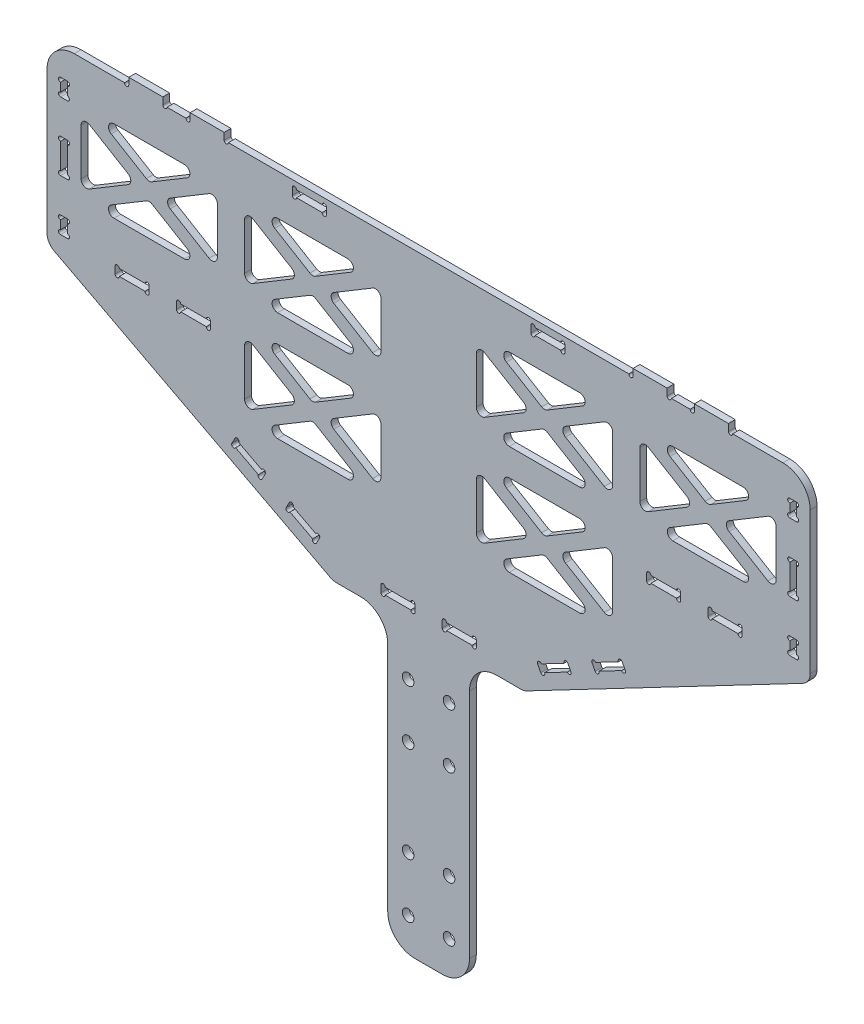
from build123d import *

# Parameters (mm, degrees)
EXTRUDE_1_DEPTH                = 5
SKETCH_2_R                     = 4.25
CUT_EXTRUDE_1_DEPTH            = 26
FILLET_1_R                     = 20
SKETCH_3_W                     = 61.624102005
SKETCH_3_H                     = 24.649640802
EXTRUDE_2_DEPTH                = 5
CUT_EXTRUDE_6_DEPTH            = 5
FILLET_2_R                     = 4
PATTERN_LINEAR_1_COUNT         = 2
PATTERN_LINEAR_1_PITCH         = 120
PATTERN_LINEAR_1_COUNT_DIR2    = 2
PATTERN_LINEAR_1_PITCH_DIR2    = 80
FILLET_2_OF_PATTERN_LINEAR_1_R = 4
MIRROR_1_DEPTH                 = 5
CUT_EXTRUDE_7_DEPTH            = 10
CUT_EXTRUDE_8_DEPTH            = 10
FILLET_3_R                     = 10
SKETCH_11_W                    = 25
SKETCH_11_H                    = 5
CUT_EXTRUDE_9_DEPTH            = 10
SKETCH_12_R                    = 1.55
CUT_EXTRUDE_10_DEPTH           = 10
SKETCH_13_W                    = 5
SKETCH_13_H                    = 12.5
SKETCH_13_H_2                  = 25
CUT_EXTRUDE_11_DEPTH           = 10
SKETCH_14_R                    = 1.55
CUT_EXTRUDE_12_DEPTH           = 10
CUT_EXTRUDE_13_DEPTH           = 10
SKETCH_16_W                    = 25
SKETCH_16_H                    = 5
EXTRUDE_3_DEPTH                = 5
SKETCH_17_R                    = 1.55
CUT_EXTRUDE_14_DEPTH           = 5


# Read off the part's stored shape, not the designer's step: 镜向1
with BuildPart() as part:
    # 草图1 → 凸台-拉伸1 (new body)
    with BuildSketch(Plane.XY):
        Polygon((-30, 0), (30, 0), (30, 210), (280, 210), (280, 450), (-280, 450), (-280, 210), (-30, 210), align=None)
    extrude(amount=EXTRUDE_1_DEPTH)

    # 草图2 → 切除-拉伸1 (cut)
    with BuildSketch(Plane.XY.offset(5)):
        with Locations((15, 25)):
            Circle(SKETCH_2_R)
        with Locations((15, 65)):
            Circle(SKETCH_2_R)
        with Locations((15, 135)):
            Circle(SKETCH_2_R)
        with Locations((15, 175)):
            Circle(SKETCH_2_R)
        with Locations(Location((-15, 175, 0), (0, 0, 180))):
            Circle(SKETCH_2_R)
        with Locations(Location((-15, 135, 0), (0, 0, 180))):
            Circle(SKETCH_2_R)
        with Locations(Location((-15, 65, 0), (0, 0, 180))):
            Circle(SKETCH_2_R)
        with Locations(Location((-15, 25, 0), (0, 0, 180))):
            Circle(SKETCH_2_R)
    extrude(amount=-CUT_EXTRUDE_1_DEPTH, mode=Mode.SUBTRACT)

    # 圆角1
    fillet_1_edges = [part.edges().sort_by_distance(p)[0] for p in [
        (30, 0, 2.5),
        (-30, 0, 2.5),
        (-30, 210, 2.5),
        (-280, 210, 2.5),
        (-280, 450, 2.5),
        (280, 450, 2.5),
        (280, 210, 2.5),
        (30, 210, 2.5),
    ]]
    fillet(fillet_1_edges, radius=FILLET_1_R)

    # 草图3 → 凸台-拉伸2 (add)
    with BuildSketch(Plane.XY.offset(5)):
        with Locations((-121.322450822, 379.637980968)):
            Rectangle(SKETCH_3_W, SKETCH_3_H)
    extrude(amount=-EXTRUDE_2_DEPTH)

    # 草图8 → 切除-拉伸6 (cut)
    with BuildSketch(Plane(origin=(0, 0, 0), x_dir=(-1, 0, 0), z_dir=(0, 0, -1))):
        Polygon((-245.281746842, 420), (-164.718253158, 420), (-205, 395.830951895), align=None)
        Polygon((-255, 414.169048105), (-255, 365.830951895), (-214.718253158, 390), align=None)
        Polygon((-245.281746842, 360), (-164.718253158, 360), (-205, 384.169048105), align=None)
        Polygon((-155, 414.169048105), (-155, 365.830951895), (-195.281746842, 390), align=None)
    cut_extrude_6 = extrude(amount=-CUT_EXTRUDE_6_DEPTH, mode=Mode.SUBTRACT)

    # 圆角2
    fillet_2_edges = [part.edges().sort_by_distance(p)[0] for p in [
        (255, 414.169048105, 2.5),
        (214.718253158, 390, 2.5),
        (255, 365.830951895, 2.5),
        (195.281746842, 390, 2.5),
        (155, 414.169048105, 2.5),
        (155, 365.830951895, 2.5),
        (205, 384.169048105, 2.5),
        (164.718253158, 360, 2.5),
        (245.281746842, 360, 2.5),
        (205, 395.830951895, 2.5),
        (245.281746842, 420, 2.5),
        (164.718253158, 420, 2.5),
    ]]
    fillet(fillet_2_edges, radius=FILLET_2_R)

    # 阵列(线性)1: Cut-Extrude 6 2 × 2, 1 skipped
    with Locations(*[(-i * PATTERN_LINEAR_1_PITCH, -j * PATTERN_LINEAR_1_PITCH_DIR2, 0) for i in range(PATTERN_LINEAR_1_COUNT) for j in range(PATTERN_LINEAR_1_COUNT_DIR2) if (i, j) not in ((0, 0), (0, 1))]):
        add(cut_extrude_6, mode=Mode.SUBTRACT)

    # 圆角2 of 阵列(线性)1
    fillet_2_of_pattern_linear_1_edges = [part.edges().sort_by_distance(p)[0] for p in [
        (135, 414.169048105, 2.5),
        (94.718253158, 390, 2.5),
        (135, 365.830951895, 2.5),
        (75.281746842, 390, 2.5),
        (35, 414.169048105, 2.5),
        (35, 365.830951895, 2.5),
        (85, 384.169048105, 2.5),
        (44.718253158, 360, 2.5),
        (125.281746842, 360, 2.5),
        (85, 395.830951895, 2.5),
        (125.281746842, 420, 2.5),
        (44.718253158, 420, 2.5),
        (135, 334.169048105, 2.5),
        (94.718253158, 310, 2.5),
        (135, 285.830951895, 2.5),
        (75.281746842, 310, 2.5),
        (35, 334.169048105, 2.5),
        (35, 285.830951895, 2.5),
        (85, 304.169048105, 2.5),
        (44.718253158, 280, 2.5),
        (125.281746842, 280, 2.5),
        (85, 315.830951895, 2.5),
        (125.281746842, 340, 2.5),
        (44.718253158, 340, 2.5),
    ]]
    fillet(fillet_2_of_pattern_linear_1_edges, radius=FILLET_2_OF_PATTERN_LINEAR_1_R)

    # 镜向1 outline → 镜向1 (cut)
    with BuildSketch(Plane.XY):
        with BuildLine():
            Line((-110.840477649, 280), (-59.159522351, 280))
            ThreePointArc((-59.159522351, 280), (-55.304662638, 282.932265672), (-57.101539329, 287.429971703))
            Line((-57.101539329, 287.429971703), (-82.942016978, 302.934258292))
            ThreePointArc((-82.942016978, 302.934258292), (-85, 303.504286589), (-87.057983022, 302.934258292))
            Line((-87.057983022, 302.934258292), (-112.898460671, 287.429971703))
            ThreePointArc((-112.898460671, 287.429971703), (-114.695337362, 282.932265672), (-110.840477649, 280))
        make_face()
        with BuildLine():
            Line((-59.159522351, 340), (-110.840477649, 340))
            ThreePointArc((-110.840477649, 340), (-114.695337362, 337.067734328), (-112.898460671, 332.570028297))
            Line((-112.898460671, 332.570028297), (-87.057983022, 317.065741708))
            ThreePointArc((-87.057983022, 317.065741708), (-85, 316.495713411), (-82.942016978, 317.065741708))
            Line((-82.942016978, 317.065741708), (-57.101539329, 332.570028297))
            ThreePointArc((-57.101539329, 332.570028297), (-55.304662638, 337.067734328), (-59.159522351, 340))
        make_face()
        with BuildLine():
            Line((-179.159522351, 420), (-230.840477649, 420))
            ThreePointArc((-230.840477649, 420), (-234.695337362, 417.067734328), (-232.898460671, 412.570028297))
            Line((-232.898460671, 412.570028297), (-207.057983022, 397.065741708))
            ThreePointArc((-207.057983022, 397.065741708), (-205, 396.495713411), (-202.942016978, 397.065741708))
            Line((-202.942016978, 397.065741708), (-177.101539329, 412.570028297))
            ThreePointArc((-177.101539329, 412.570028297), (-175.304662638, 417.067734328), (-179.159522351, 420))
        make_face()
        with BuildLine():
            Line((-59.159522351, 420), (-110.840477649, 420))
            ThreePointArc((-110.840477649, 420), (-114.695337362, 417.067734328), (-112.898460671, 412.570028297))
            Line((-112.898460671, 412.570028297), (-87.057983022, 397.065741708))
            ThreePointArc((-87.057983022, 397.065741708), (-85, 396.495713411), (-82.942016978, 397.065741708))
            Line((-82.942016978, 397.065741708), (-57.101539329, 412.570028297))
            ThreePointArc((-57.101539329, 412.570028297), (-55.304662638, 417.067734328), (-59.159522351, 420))
        make_face()
        with BuildLine():
            Line((-230.840477649, 360), (-179.159522351, 360))
            ThreePointArc((-179.159522351, 360), (-175.304662638, 362.932265672), (-177.101539329, 367.429971703))
            Line((-177.101539329, 367.429971703), (-202.942016978, 382.934258292))
            ThreePointArc((-202.942016978, 382.934258292), (-205, 383.504286589), (-207.057983022, 382.934258292))
            Line((-207.057983022, 382.934258292), (-232.898460671, 367.429971703))
            ThreePointArc((-232.898460671, 367.429971703), (-234.695337362, 362.932265672), (-230.840477649, 360))
        make_face()
        with BuildLine():
            Line((-110.840477649, 360), (-59.159522351, 360))
            ThreePointArc((-59.159522351, 360), (-55.304662638, 362.932265672), (-57.101539329, 367.429971703))
            Line((-57.101539329, 367.429971703), (-82.942016978, 382.934258292))
            ThreePointArc((-82.942016978, 382.934258292), (-85, 383.504286589), (-87.057983022, 382.934258292))
            Line((-87.057983022, 382.934258292), (-112.898460671, 367.429971703))
            ThreePointArc((-112.898460671, 367.429971703), (-114.695337362, 362.932265672), (-110.840477649, 360))
        make_face()
        with BuildLine():
            Line((-248.942016978, 369.465741708), (-220.434872663, 386.570028297))
            ThreePointArc((-220.434872663, 386.570028297), (-218.492855685, 390), (-220.434872663, 393.429971703))
            Line((-220.434872663, 393.429971703), (-248.942016978, 410.534258292))
            ThreePointArc((-248.942016978, 410.534258292), (-252.97079526, 410.585086216), (-255, 407.104286589))
            Line((-255, 407.104286589), (-255, 372.895713411))
            ThreePointArc((-255, 372.895713411), (-252.97079526, 369.414913784), (-248.942016978, 369.465741708))
        make_face()
        with BuildLine():
            Line((-189.565127337, 386.570028297), (-161.057983022, 369.465741708))
            ThreePointArc((-161.057983022, 369.465741708), (-157.02920474, 369.414913784), (-155, 372.895713411))
            Line((-155, 372.895713411), (-155, 407.104286589))
            ThreePointArc((-155, 407.104286589), (-157.02920474, 410.585086216), (-161.057983022, 410.534258292))
            Line((-161.057983022, 410.534258292), (-189.565127337, 393.429971703))
            ThreePointArc((-189.565127337, 393.429971703), (-191.507144315, 390), (-189.565127337, 386.570028297))
        make_face()
        with BuildLine():
            Line((-128.942016978, 289.465741708), (-100.434872663, 306.570028297))
            ThreePointArc((-100.434872663, 306.570028297), (-98.492855685, 310), (-100.434872663, 313.429971703))
            Line((-100.434872663, 313.429971703), (-128.942016978, 330.534258292))
            ThreePointArc((-128.942016978, 330.534258292), (-132.97079526, 330.585086216), (-135, 327.104286589))
            Line((-135, 327.104286589), (-135, 292.895713411))
            ThreePointArc((-135, 292.895713411), (-132.97079526, 289.414913784), (-128.942016978, 289.465741708))
        make_face()
        with BuildLine():
            Line((-135, 407.104286589), (-135, 372.895713411))
            ThreePointArc((-135, 372.895713411), (-132.97079526, 369.414913784), (-128.942016978, 369.465741708))
            Line((-128.942016978, 369.465741708), (-100.434872663, 386.570028297))
            ThreePointArc((-100.434872663, 386.570028297), (-98.492855685, 390), (-100.434872663, 393.429971703))
            Line((-100.434872663, 393.429971703), (-128.942016978, 410.534258292))
            ThreePointArc((-128.942016978, 410.534258292), (-132.97079526, 410.585086216), (-135, 407.104286589))
        make_face()
        with BuildLine():
            Line((-35, 292.895713411), (-35, 327.104286589))
            ThreePointArc((-35, 327.104286589), (-37.02920474, 330.585086216), (-41.057983022, 330.534258292))
            Line((-41.057983022, 330.534258292), (-69.565127337, 313.429971703))
            ThreePointArc((-69.565127337, 313.429971703), (-71.507144315, 310), (-69.565127337, 306.570028297))
            Line((-69.565127337, 306.570028297), (-41.057983022, 289.465741708))
            ThreePointArc((-41.057983022, 289.465741708), (-37.02920474, 289.414913784), (-35, 292.895713411))
        make_face()
        with BuildLine():
            Line((-35, 372.895713411), (-35, 407.104286589))
            ThreePointArc((-35, 407.104286589), (-37.02920474, 410.585086216), (-41.057983022, 410.534258292))
            Line((-41.057983022, 410.534258292), (-69.565127337, 393.429971703))
            ThreePointArc((-69.565127337, 393.429971703), (-71.507144315, 390), (-69.565127337, 386.570028297))
            Line((-69.565127337, 386.570028297), (-41.057983022, 369.465741708))
            ThreePointArc((-41.057983022, 369.465741708), (-37.02920474, 369.414913784), (-35, 372.895713411))
        make_face()
    extrude(amount=MIRROR_1_DEPTH, mode=Mode.SUBTRACT)

    # 草图9 → 切除-拉伸7 (cut)
    with BuildSketch(Plane(origin=(0, 0, 0), x_dir=(-1, 0, 0), z_dir=(0, 0, -1))):
        with BuildLine():
            Line((78.1, 445), (96.9, 445))
            ThreePointArc((96.9, 445), (98.45, 446.55), (100, 445))
            Line((100, 445), (100, 440))
            ThreePointArc((100, 440), (98.45, 438.45), (96.9, 440))
            Line((96.9, 440), (78.1, 440))
            ThreePointArc((78.1, 440), (76.55, 438.45), (75, 440))
            Line((75, 440), (75, 445))
            ThreePointArc((75, 445), (76.55, 446.55), (78.1, 445))
        make_face()
        with BuildLine():
            Line((-100, 445), (-100, 440))
            ThreePointArc((-100, 440), (-98.45, 438.45), (-96.9, 440))
            Line((-96.9, 440), (-78.1, 440))
            ThreePointArc((-78.1, 440), (-76.55, 438.45), (-75, 440))
            Line((-75, 440), (-75, 445))
            ThreePointArc((-75, 445), (-76.55, 446.55), (-78.1, 445))
            Line((-78.1, 445), (-96.9, 445))
            ThreePointArc((-96.9, 445), (-98.45, 446.55), (-100, 445))
        make_face()
    extrude(amount=-CUT_EXTRUDE_7_DEPTH, mode=Mode.SUBTRACT)

    # 草图10 → 切除-拉伸8 (cut)
    with BuildSketch(Plane.XY.offset(5)):
        with BuildLine():
            Line((280, 320), (70, 210))
            Line((70, 210), (260, 210))
            ThreePointArc((260, 210), (274.142135624, 215.857864376), (280, 230))
            Line((280, 230), (280, 320))
        make_face()
        with BuildLine():
            Line((-280, 320), (-70, 210))
            Line((-70, 210), (-260, 210))
            ThreePointArc((-260, 210), (-274.142135624, 215.857864376), (-280, 230))
            Line((-280, 230), (-280, 320))
        make_face()
    extrude(amount=-CUT_EXTRUDE_8_DEPTH, mode=Mode.SUBTRACT)

    # 圆角3
    fillet_3_edges = [part.edges().sort_by_distance(p)[0] for p in [
        (280, 320, 2.5),
        (70, 210, 2.5),
        (-280, 320, 2.5),
        (-70, 210, 2.5),
    ]]
    fillet(fillet_3_edges, radius=FILLET_3_R)

    # 草图11 → 切除-拉伸9 (cut)
    with BuildSketch(Plane.XY.offset(5)):
        with Locations((172.5, 327.5)):
            Rectangle(SKETCH_11_W, SKETCH_11_H)
        with Locations((217.5, 327.5)):
            Rectangle(SKETCH_11_W, SKETCH_11_H)
        with Locations((-217.5, 327.5)):
            Rectangle(SKETCH_11_W, SKETCH_11_H)
        with Locations((-172.5, 327.5)):
            Rectangle(SKETCH_11_W, SKETCH_11_H)
    extrude(amount=-CUT_EXTRUDE_9_DEPTH, mode=Mode.SUBTRACT)

    # 草图12 → 切除-拉伸10 (cut)
    with BuildSketch(Plane.XY.offset(5)):
        with Locations((228.45, 330)):
            Circle(SKETCH_12_R)
        with Locations((206.55, 330)):
            Circle(SKETCH_12_R)
        with Locations((228.45, 325)):
            Circle(SKETCH_12_R)
        with Locations((206.55, 325)):
            Circle(SKETCH_12_R)
        with Locations((183.45, 330)):
            Circle(SKETCH_12_R)
        with Locations((161.55, 330)):
            Circle(SKETCH_12_R)
        with Locations((161.55, 325)):
            Circle(SKETCH_12_R)
        with Locations((183.45, 325)):
            Circle(SKETCH_12_R)
        with Locations((-183.45, 325)):
            Circle(SKETCH_12_R)
        with Locations((-161.55, 325)):
            Circle(SKETCH_12_R)
        with Locations((-161.55, 330)):
            Circle(SKETCH_12_R)
        with Locations((-183.45, 330)):
            Circle(SKETCH_12_R)
        with Locations((-206.55, 325)):
            Circle(SKETCH_12_R)
        with Locations((-228.45, 325)):
            Circle(SKETCH_12_R)
        with Locations((-206.55, 330)):
            Circle(SKETCH_12_R)
        with Locations((-228.45, 330)):
            Circle(SKETCH_12_R)
    extrude(amount=-CUT_EXTRUDE_10_DEPTH, mode=Mode.SUBTRACT)

    # 草图13 → 切除-拉伸11 (cut)
    with BuildSketch(Plane(origin=(0, 0, 0), x_dir=(-1, 0, 0), z_dir=(0, 0, -1))):
        with Locations((-267.5, 423.75)):
            Rectangle(SKETCH_13_W, SKETCH_13_H)
        with Locations((-267.5, 380)):
            Rectangle(SKETCH_13_W, SKETCH_13_H_2)
        with Locations((-267.5, 336.25)):
            Rectangle(SKETCH_13_W, SKETCH_13_H)
        with Locations((267.5, 336.25)):
            Rectangle(SKETCH_13_W, SKETCH_13_H)
        with Locations((267.5, 380)):
            Rectangle(SKETCH_13_W, SKETCH_13_H_2)
        with Locations((267.5, 423.75)):
            Rectangle(SKETCH_13_W, SKETCH_13_H)
    extrude(amount=-CUT_EXTRUDE_11_DEPTH, mode=Mode.SUBTRACT)

    # 草图14 → 切除-拉伸12 (cut)
    with BuildSketch(Plane(origin=(0, 0, 0), x_dir=(-1, 0, 0), z_dir=(0, 0, -1))):
        with Locations((-265, 428.45)):
            Circle(SKETCH_14_R)
        with Locations((-265, 419.05)):
            Circle(SKETCH_14_R)
        with Locations((-270, 428.45)):
            Circle(SKETCH_14_R)
        with Locations((-270, 419.05)):
            Circle(SKETCH_14_R)
        with Locations((-265, 390.95)):
            Circle(SKETCH_14_R)
        with Locations((-270, 390.95)):
            Circle(SKETCH_14_R)
        with Locations((-265, 369.05)):
            Circle(SKETCH_14_R)
        with Locations((-270, 369.05)):
            Circle(SKETCH_14_R)
        with Locations((-265, 340.95)):
            Circle(SKETCH_14_R)
        with Locations((-270, 340.95)):
            Circle(SKETCH_14_R)
        with Locations((-265, 331.55)):
            Circle(SKETCH_14_R)
        with Locations((-270, 331.55)):
            Circle(SKETCH_14_R)
        with Locations((270, 331.55)):
            Circle(SKETCH_14_R)
        with Locations((265, 331.55)):
            Circle(SKETCH_14_R)
        with Locations((270, 340.95)):
            Circle(SKETCH_14_R)
        with Locations((265, 340.95)):
            Circle(SKETCH_14_R)
        with Locations((270, 369.05)):
            Circle(SKETCH_14_R)
        with Locations((265, 369.05)):
            Circle(SKETCH_14_R)
        with Locations((270, 390.95)):
            Circle(SKETCH_14_R)
        with Locations((265, 390.95)):
            Circle(SKETCH_14_R)
        with Locations((270, 419.05)):
            Circle(SKETCH_14_R)
        with Locations((270, 428.45)):
            Circle(SKETCH_14_R)
        with Locations((265, 419.05)):
            Circle(SKETCH_14_R)
        with Locations((265, 428.45)):
            Circle(SKETCH_14_R)
    extrude(amount=-CUT_EXTRUDE_12_DEPTH, mode=Mode.SUBTRACT)

    # 草图15 → 切除-拉伸13 (cut)
    with BuildSketch(Plane.XY.offset(5)):
        with BuildLine():
            Line((-139.26212971, 263.213405455), (-122.608496847, 254.490073955))
            ThreePointArc((-122.608496847, 254.490073955), (-120.516247126, 255.143901993), (-119.862419088, 253.051652271))
            Line((-119.862419088, 253.051652271), (-122.182454061, 248.622494595))
            ThreePointArc((-122.182454061, 248.622494595), (-124.274703782, 247.968666557), (-124.92853182, 250.060916278))
            Line((-124.92853182, 250.060916278), (-141.582164684, 258.784247778))
            ThreePointArc((-141.582164684, 258.784247778), (-143.674414405, 258.13041974), (-144.328242443, 260.222669462))
            Line((-144.328242443, 260.222669462), (-142.00820747, 264.651827138))
            ThreePointArc((-142.00820747, 264.651827138), (-139.915957748, 265.305655176), (-139.26212971, 263.213405455))
        make_face()
        with BuildLine():
            Line((-102.145788382, 243.771512378), (-104.465823355, 239.342354702))
            ThreePointArc((-104.465823355, 239.342354702), (-103.811995317, 237.25010498), (-101.719745596, 237.903933018))
            Line((-101.719745596, 237.903933018), (-85.066112733, 229.180601518))
            ThreePointArc((-85.066112733, 229.180601518), (-84.412284695, 227.088351797), (-82.320034973, 227.742179835))
            Line((-82.320034973, 227.742179835), (-80, 232.171337511))
            ThreePointArc((-80, 232.171337511), (-80.653828038, 234.263587233), (-82.746077759, 233.609759195))
            Line((-82.746077759, 233.609759195), (-99.399710623, 242.333090694))
            ThreePointArc((-99.399710623, 242.333090694), (-100.053538661, 244.425340416), (-102.145788382, 243.771512378))
        make_face()
        with BuildLine():
            Line((10, 225), (10, 220))
            ThreePointArc((10, 220), (11.55, 218.45), (13.1, 220))
            Line((13.1, 220), (31.9, 220))
            ThreePointArc((31.9, 220), (33.45, 218.45), (35, 220))
            Line((35, 220), (35, 225))
            ThreePointArc((35, 225), (33.45, 226.55), (31.9, 225))
            Line((31.9, 225), (13.1, 225))
            ThreePointArc((13.1, 225), (11.55, 226.55), (10, 225))
        make_face()
        with BuildLine():
            Line((-31.9, 225), (-13.1, 225))
            ThreePointArc((-13.1, 225), (-11.55, 226.55), (-10, 225))
            Line((-10, 225), (-10, 220))
            ThreePointArc((-10, 220), (-11.55, 218.45), (-13.1, 220))
            Line((-13.1, 220), (-31.9, 220))
            ThreePointArc((-31.9, 220), (-33.45, 218.45), (-35, 220))
            Line((-35, 220), (-35, 225))
            ThreePointArc((-35, 225), (-33.45, 226.55), (-31.9, 225))
        make_face()
        with BuildLine():
            Line((82.746077759, 233.609759195), (99.399710623, 242.333090694))
            ThreePointArc((99.399710623, 242.333090694), (100.053538661, 244.425340416), (102.145788382, 243.771512378))
            Line((102.145788382, 243.771512378), (104.465823355, 239.342354702))
            ThreePointArc((104.465823355, 239.342354702), (103.811995317, 237.25010498), (101.719745596, 237.903933018))
            Line((101.719745596, 237.903933018), (85.066112733, 229.180601518))
            ThreePointArc((85.066112733, 229.180601518), (84.412284695, 227.088351797), (82.320034973, 227.742179835))
            Line((82.320034973, 227.742179835), (80, 232.171337511))
            ThreePointArc((80, 232.171337511), (80.653828038, 234.263587233), (82.746077759, 233.609759195))
        make_face()
        with BuildLine():
            Line((144.328242443, 260.222669462), (142.00820747, 264.651827138))
            ThreePointArc((142.00820747, 264.651827138), (139.915957748, 265.305655176), (139.26212971, 263.213405455))
            Line((139.26212971, 263.213405455), (122.608496847, 254.490073955))
            ThreePointArc((122.608496847, 254.490073955), (120.516247126, 255.143901993), (119.862419088, 253.051652271))
            Line((119.862419088, 253.051652271), (122.182454061, 248.622494595))
            ThreePointArc((122.182454061, 248.622494595), (124.274703782, 247.968666557), (124.92853182, 250.060916278))
            Line((124.92853182, 250.060916278), (141.582164684, 258.784247778))
            ThreePointArc((141.582164684, 258.784247778), (143.674414405, 258.13041974), (144.328242443, 260.222669462))
        make_face()
    extrude(amount=-CUT_EXTRUDE_13_DEPTH, mode=Mode.SUBTRACT)

    # 草图16 → 凸台-拉伸3 (add)
    with BuildSketch(Plane.XY.offset(5)):
        with Locations((162.5, 452.5)):
            Rectangle(SKETCH_16_W, SKETCH_16_H)
        with Locations((-207.5, 452.5)):
            Rectangle(SKETCH_16_W, SKETCH_16_H)
        with Locations((207.5, 452.5)):
            Rectangle(SKETCH_16_W, SKETCH_16_H)
        with Locations((-162.5, 452.5)):
            Rectangle(SKETCH_16_W, SKETCH_16_H)
    extrude(amount=-EXTRUDE_3_DEPTH)

    # 草图17 → 切除-拉伸14 (cut)
    with BuildSketch(Plane.XY.offset(5)):
        with Locations((148.45, 450)):
            Circle(SKETCH_17_R)
        with Locations((176.55, 450)):
            Circle(SKETCH_17_R)
        with Locations((193.45, 450)):
            Circle(SKETCH_17_R)
        with Locations((221.55, 450)):
            Circle(SKETCH_17_R)
        with Locations((-221.55, 450)):
            Circle(SKETCH_17_R)
        with Locations((-193.45, 450)):
            Circle(SKETCH_17_R)
        with Locations((-176.55, 450)):
            Circle(SKETCH_17_R)
        with Locations((-148.45, 450)):
            Circle(SKETCH_17_R)
    extrude(amount=-CUT_EXTRUDE_14_DEPTH, mode=Mode.SUBTRACT)


solid = part.part
